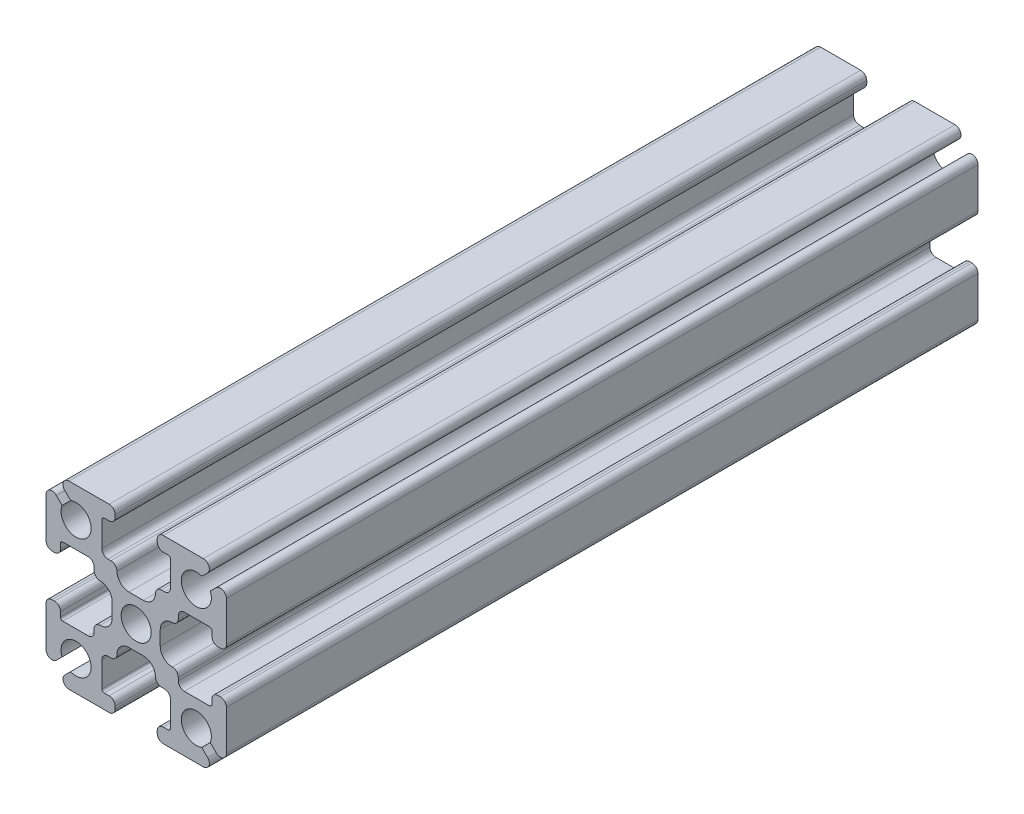
from build123d import *

# Parameters (mm, degrees)
SKETCH1_R           = 1.25
BOSS_EXTRUDE1_DEPTH = 62.5


with BuildPart() as part:
    # Sketch1 → Boss-Extrude1 (new body)
    with BuildSketch(Plane.XY):
        with BuildLine():
            Line((6.646446609, 5.939339828), (6.163645978, 5.456539197))
            ThreePointArc((6.163645978, 5.456539197), (4.116116524, 4.116116524), (5.456539197, 6.163645978))
            Line((5.456539197, 6.163645978), (5.939339828, 6.646446609))
            ThreePointArc((5.939339828, 6.646446609), (6.047726204, 7.191341716), (5.585786438, 7.5))
            Line((5.585786438, 7.5), (2.25, 7.5))
            ThreePointArc((2.25, 7.5), (1.896446609, 7.353553391), (1.75, 7))
            Line((1.75, 7), (1.75, 6.8))
            ThreePointArc((1.75, 6.8), (1.896446609, 6.446446609), (2.25, 6.3))
            Line((2.25, 6.3), (2.65, 6.3))
            ThreePointArc((2.65, 6.3), (2.791421356, 6.241421356), (2.85, 6.1))
            Line((2.85, 6.1), (2.85, 4))
            ThreePointArc((2.85, 4), (2.703553391, 3.646446609), (2.35, 3.5))
            Line((2.35, 3.5), (2.1, 3.5))
            ThreePointArc((2.1, 3.5), (1.746446609, 3.353553391), (1.6, 3))
            ThreePointArc((1.6, 3), (1.307106781, 2.292893219), (0.6, 2))
            Line((0.6, 2), (-0.6, 2))
            ThreePointArc((-0.6, 2), (-1.307106781, 2.292893219), (-1.6, 3))
            ThreePointArc((-1.6, 3), (-1.746446609, 3.353553391), (-2.1, 3.5))
            Line((-2.1, 3.5), (-2.35, 3.5))
            ThreePointArc((-2.35, 3.5), (-2.703553391, 3.646446609), (-2.85, 4))
            Line((-2.85, 4), (-2.85, 6.1))
            ThreePointArc((-2.85, 6.1), (-2.791421356, 6.241421356), (-2.65, 6.3))
            Line((-2.65, 6.3), (-2.25, 6.3))
            ThreePointArc((-2.25, 6.3), (-1.896446609, 6.446446609), (-1.75, 6.8))
            Line((-1.75, 6.8), (-1.75, 7))
            ThreePointArc((-1.75, 7), (-1.896446609, 7.353553391), (-2.25, 7.5))
            Line((-2.25, 7.5), (-5.585786438, 7.5))
            ThreePointArc((-5.585786438, 7.5), (-6.047726204, 7.191341716), (-5.939339828, 6.646446609))
            Line((-5.939339828, 6.646446609), (-5.456539197, 6.163645978))
            ThreePointArc((-5.456539197, 6.163645978), (-4.116116524, 4.116116524), (-6.163645978, 5.456539197))
            Line((-6.163645978, 5.456539197), (-6.646446609, 5.939339828))
            ThreePointArc((-6.646446609, 5.939339828), (-7.191341716, 6.047726204), (-7.5, 5.585786438))
            Line((-7.5, 5.585786438), (-7.5, 2.25))
            ThreePointArc((-7.5, 2.25), (-7.353553391, 1.896446609), (-7, 1.75))
            Line((-7, 1.75), (-6.8, 1.75))
            ThreePointArc((-6.8, 1.75), (-6.446446609, 1.896446609), (-6.3, 2.25))
            Line((-6.3, 2.25), (-6.3, 2.65))
            ThreePointArc((-6.3, 2.65), (-6.241421356, 2.791421356), (-6.1, 2.85))
            Line((-6.1, 2.85), (-4, 2.85))
            ThreePointArc((-4, 2.85), (-3.646446609, 2.703553391), (-3.5, 2.35))
            Line((-3.5, 2.35), (-3.5, 2.1))
            ThreePointArc((-3.5, 2.1), (-3.353553391, 1.746446609), (-3, 1.6))
            ThreePointArc((-3, 1.6), (-2.292893219, 1.307106781), (-2, 0.6))
            Line((-2, 0.6), (-2, -0.6))
            ThreePointArc((-2, -0.6), (-2.292893219, -1.307106781), (-3, -1.6))
            ThreePointArc((-3, -1.6), (-3.353553391, -1.746446609), (-3.5, -2.1))
            Line((-3.5, -2.1), (-3.5, -2.35))
            ThreePointArc((-3.5, -2.35), (-3.646446609, -2.703553391), (-4, -2.85))
            Line((-4, -2.85), (-6.1, -2.85))
            ThreePointArc((-6.1, -2.85), (-6.241421356, -2.791421356), (-6.3, -2.65))
            Line((-6.3, -2.65), (-6.3, -2.25))
            ThreePointArc((-6.3, -2.25), (-6.446446609, -1.896446609), (-6.8, -1.75))
            Line((-6.8, -1.75), (-7, -1.75))
            ThreePointArc((-7, -1.75), (-7.353553391, -1.896446609), (-7.5, -2.25))
            Line((-7.5, -2.25), (-7.5, -5.585786438))
            ThreePointArc((-7.5, -5.585786438), (-7.191341716, -6.047726204), (-6.646446609, -5.939339828))
            Line((-6.646446609, -5.939339828), (-6.163645978, -5.456539197))
            ThreePointArc((-6.163645978, -5.456539197), (-4.116116524, -4.116116524), (-5.456539197, -6.163645978))
            Line((-5.456539197, -6.163645978), (-5.939339828, -6.646446609))
            ThreePointArc((-5.939339828, -6.646446609), (-6.047726204, -7.191341716), (-5.585786438, -7.5))
            Line((-5.585786438, -7.5), (-2.25, -7.5))
            ThreePointArc((-2.25, -7.5), (-1.896446609, -7.353553391), (-1.75, -7))
            Line((-1.75, -7), (-1.75, -6.8))
            ThreePointArc((-1.75, -6.8), (-1.896446609, -6.446446609), (-2.25, -6.3))
            Line((-2.25, -6.3), (-2.65, -6.3))
            ThreePointArc((-2.65, -6.3), (-2.791421356, -6.241421356), (-2.85, -6.1))
            Line((-2.85, -6.1), (-2.85, -4))
            ThreePointArc((-2.85, -4), (-2.703553391, -3.646446609), (-2.35, -3.5))
            Line((-2.35, -3.5), (-2.1, -3.5))
            ThreePointArc((-2.1, -3.5), (-1.746446609, -3.353553391), (-1.6, -3))
            ThreePointArc((-1.6, -3), (-1.307106781, -2.292893219), (-0.6, -2))
            Line((-0.6, -2), (0.6, -2))
            ThreePointArc((0.6, -2), (1.307106781, -2.292893219), (1.6, -3))
            ThreePointArc((1.6, -3), (1.746446609, -3.353553391), (2.1, -3.5))
            Line((2.1, -3.5), (2.35, -3.5))
            ThreePointArc((2.35, -3.5), (2.703553391, -3.646446609), (2.85, -4))
            Line((2.85, -4), (2.85, -6.1))
            ThreePointArc((2.85, -6.1), (2.791421356, -6.241421356), (2.65, -6.3))
            Line((2.65, -6.3), (2.25, -6.3))
            ThreePointArc((2.25, -6.3), (1.896446609, -6.446446609), (1.75, -6.8))
            Line((1.75, -6.8), (1.75, -7))
            ThreePointArc((1.75, -7), (1.896446609, -7.353553391), (2.25, -7.5))
            Line((2.25, -7.5), (5.585786438, -7.5))
            ThreePointArc((5.585786438, -7.5), (6.047726204, -7.191341716), (5.939339828, -6.646446609))
            Line((5.939339828, -6.646446609), (5.456539197, -6.163645978))
            ThreePointArc((5.456539197, -6.163645978), (4.116116524, -4.116116524), (6.163645978, -5.456539197))
            Line((6.163645978, -5.456539197), (6.646446609, -5.939339828))
            ThreePointArc((6.646446609, -5.939339828), (7.191341716, -6.047726204), (7.5, -5.585786438))
            Line((7.5, -5.585786438), (7.5, -2.25))
            ThreePointArc((7.5, -2.25), (7.353553391, -1.896446609), (7, -1.75))
            Line((7, -1.75), (6.8, -1.75))
            ThreePointArc((6.8, -1.75), (6.446446609, -1.896446609), (6.3, -2.25))
            Line((6.3, -2.25), (6.3, -2.65))
            ThreePointArc((6.3, -2.65), (6.241421356, -2.791421356), (6.1, -2.85))
            Line((6.1, -2.85), (4, -2.85))
            ThreePointArc((4, -2.85), (3.646446609, -2.703553391), (3.5, -2.35))
            Line((3.5, -2.35), (3.5, -2.1))
            ThreePointArc((3.5, -2.1), (3.353553391, -1.746446609), (3, -1.6))
            ThreePointArc((3, -1.6), (2.292893219, -1.307106781), (2, -0.6))
            Line((2, -0.6), (2, 0.6))
            ThreePointArc((2, 0.6), (2.292893219, 1.307106781), (3, 1.6))
            ThreePointArc((3, 1.6), (3.353553391, 1.746446609), (3.5, 2.1))
            Line((3.5, 2.1), (3.5, 2.35))
            ThreePointArc((3.5, 2.35), (3.646446609, 2.703553391), (4, 2.85))
            Line((4, 2.85), (6.1, 2.85))
            ThreePointArc((6.1, 2.85), (6.241421356, 2.791421356), (6.3, 2.65))
            Line((6.3, 2.65), (6.3, 2.25))
            ThreePointArc((6.3, 2.25), (6.446446609, 1.896446609), (6.8, 1.75))
            Line((6.8, 1.75), (7, 1.75))
            ThreePointArc((7, 1.75), (7.353553391, 1.896446609), (7.5, 2.25))
            Line((7.5, 2.25), (7.5, 5.585786438))
            ThreePointArc((7.5, 5.585786438), (7.191341716, 6.047726204), (6.646446609, 5.939339828))
        make_face()
        Circle(SKETCH1_R, mode=Mode.SUBTRACT)
    extrude(amount=BOSS_EXTRUDE1_DEPTH)


solid = part.part
